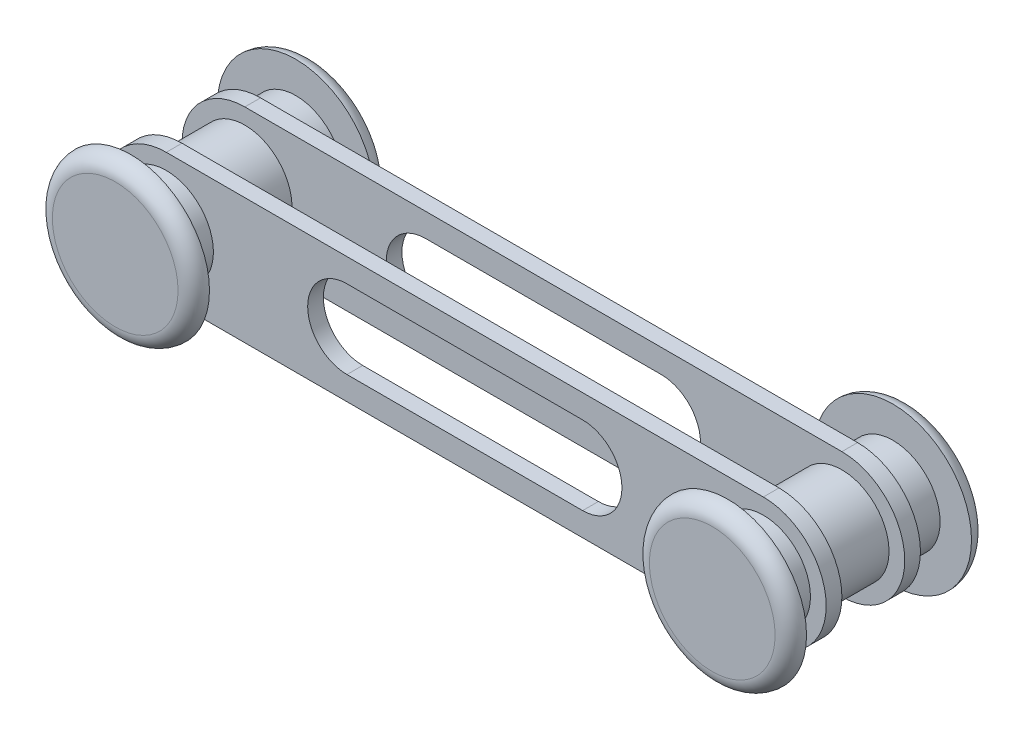
from build123d import *

# Parameters (mm, degrees)
SKETCH2_R            = 30
BOSS_EXTRUDE1_DEPTH  = 52.5
BOSS_EXTRUDE2_DEPTH  = 10
CUT_EXTRUDE1_DEPTH   = 430.890974551
SKETCH5_R            = 30
BOSS_EXTRUDE3_DEPTH  = 52.5
SKETCH6_R            = 50
BOSS_EXTRUDE4_DEPTH  = 10
FILLET1_R            = 10
FILLET1_OF_MIRROR3_R = 10


with BuildPart() as part:
    # Sketch2 → Boss-Extrude1 (new, symmetric)
    with BuildSketch(Plane.XY):
        Circle(SKETCH2_R)
    extrude(amount=BOSS_EXTRUDE1_DEPTH, both=True)

    # Sketch3 → Boss-Extrude2 (add)
    with BuildSketch(Plane.XY.offset(30)):
        with BuildLine():
            Line((0, 40), (380, 40))
            ThreePointArc((380, 40), (420, 0), (380, -40))
            Line((380, -40), (0, -40))
            ThreePointArc((0, -40), (-40, 0), (0, 40))
        make_face()
    boss_extrude2 = extrude(amount=-BOSS_EXTRUDE2_DEPTH)

    # Sketch4 → Cut-Extrude1 (cut, through all)
    with BuildSketch(Plane.XY.offset(30)):
        with BuildLine():
            Line((265, -25), (115, -25))
            ThreePointArc((115, -25), (90, 0), (115, 25))
            Line((115, 25), (265, 25))
            ThreePointArc((265, 25), (290, 0), (265, -25))
        make_face()
    cut_extrude1 = extrude(amount=-CUT_EXTRUDE1_DEPTH, mode=Mode.SUBTRACT)

    # Sketch5 → Boss-Extrude3 (add, symmetric)
    with BuildSketch(Plane.XY):
        with Locations((380, 0)):
            Circle(SKETCH5_R)
    extrude(amount=BOSS_EXTRUDE3_DEPTH, both=True)

    # Mirror1: Boss-Extrude2, Cut-Extrude1 across plane
    add(boss_extrude2.mirror(Plane.XY))
    add(cut_extrude1.mirror(Plane.XY), mode=Mode.SUBTRACT)

    # Sketch6 → Boss-Extrude4 (add)
    with BuildSketch(Plane.XY.offset(52.5)):
        Circle(SKETCH6_R)
        with Locations((380, 0)):
            Circle(SKETCH6_R)
    boss_extrude4 = extrude(amount=BOSS_EXTRUDE4_DEPTH)

    # Fillet1
    fillet1_edges = [part.edges().sort_by_distance(p)[0] for p in [
        (-50, 0, 62.5),
        (330, 0, 62.5),
    ]]
    fillet(fillet1_edges, radius=FILLET1_R - 0.0001)  # a hair under: the kernel refuses the full size

    # Mirror3: Boss-Extrude4 across plane
    add(boss_extrude4.mirror(Plane.XY))

    # Fillet1 of Mirror3
    fillet1_of_mirror3_edges = [part.edges().sort_by_distance(p)[0] for p in [
        (-50, 0, -62.5),
        (330, 0, -62.5),
    ]]
    fillet(fillet1_of_mirror3_edges, radius=FILLET1_OF_MIRROR3_R - 0.0001)  # a hair under: the kernel refuses the full size


solid = part.part
